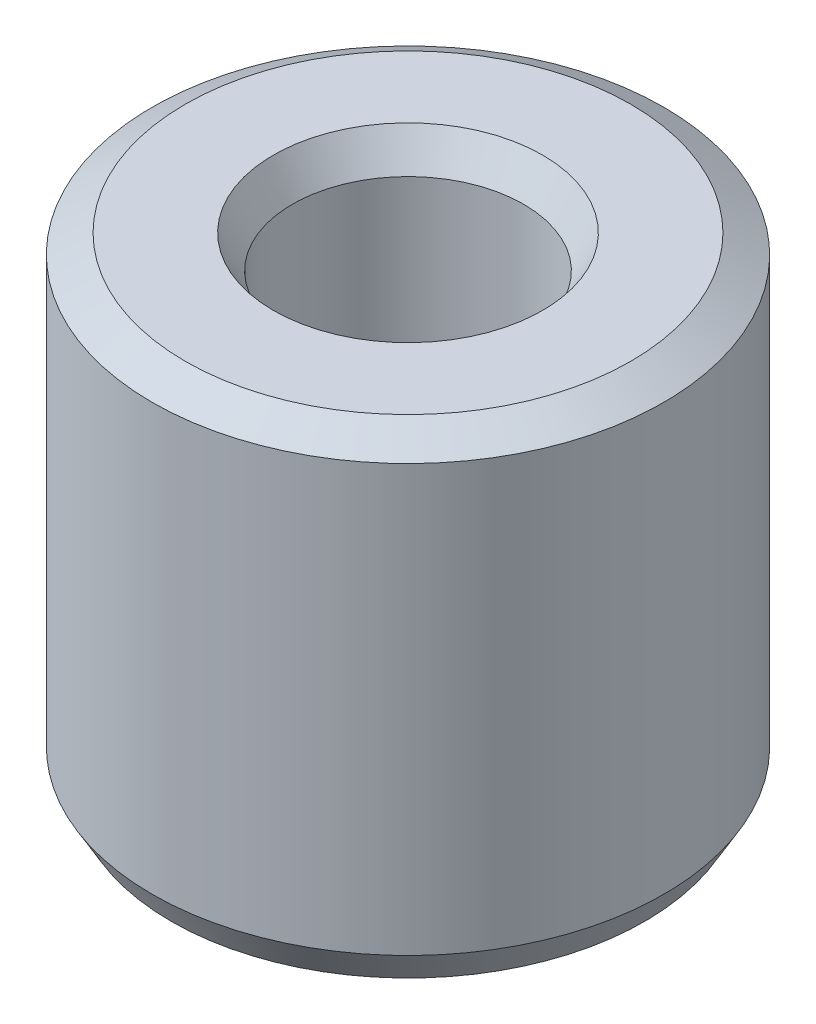
from build123d import *
from OCP.BRepFilletAPI import BRepFilletAPI_MakeChamfer

# Parameters (mm, degrees)
SKETCH1_R           = 5
BOSS_EXTRUDE1_DEPTH = 9.347865609
SKETCH2_R           = 2.259194326
CUT_EXTRUDE1_DEPTH  = 12.721032013
CHAMFER1_SIZE       = 0.372725483
CHAMFER1_SIZE2      = 0.645579473


with BuildPart() as part:
    # Sketch1 → Boss-Extrude1 (new body)
    with BuildSketch(Plane(origin=(0, 0, 0), x_dir=(1, 0, 0), z_dir=(0, 1, 0))):
        Circle(SKETCH1_R)
    extrude(amount=BOSS_EXTRUDE1_DEPTH)

    # Sketch2 → Cut-Extrude1 (cut, through all)
    with BuildSketch(Plane(origin=(0, 0, 0), x_dir=(1, 0, 0), z_dir=(0, 1, 0))):
        Circle(SKETCH2_R)
    extrude(amount=CUT_EXTRUDE1_DEPTH, mode=Mode.SUBTRACT)

    # Chamfer1: one chamfer whose edges measure the first distance from different faces: ONE call of the kernel's chamfer builder (chamfer() names one face for all edges)
    chamfer1_edges_1 = [part.edges().sort_by_distance(p)[0] for p in [
        (-2.259194326, 9.347865609, 0),
    ]]
    chamfer1_side_1 = [part.faces().sort_by_distance(p)[0] for p in [
        (-4.858578644, 9.347865609, 0),
    ]]
    chamfer1_edges_2 = [part.edges().sort_by_distance(p)[0] for p in [
        (-2.259194326, 0, 0),
    ]]
    chamfer1_side_2 = [part.faces().sort_by_distance(p)[0] for p in [
        (-2.259194326, 4.673932805, 0),
    ]]
    chamfer1_edges_3 = [part.edges().sort_by_distance(p)[0] for p in [
        (-5, 0, 0),
    ]]
    chamfer1_side_3 = [part.faces().sort_by_distance(p)[0] for p in [
        (-4.858578644, 0, 0),
    ]]
    chamfer1_edges_4 = [part.edges().sort_by_distance(p)[0] for p in [
        (-5, 9.347865609, 0),
    ]]
    chamfer1_side_4 = [part.faces().sort_by_distance(p)[0] for p in [
        (-5, 4.673932805, 0),
    ]]
    chamfer1 = BRepFilletAPI_MakeChamfer(part.part.solid().wrapped)
    for e in chamfer1_edges_1:
        chamfer1.Add(CHAMFER1_SIZE, CHAMFER1_SIZE2, e.wrapped, chamfer1_side_1[0].wrapped)  # the first distance lies on this face
    for e in chamfer1_edges_2:
        chamfer1.Add(CHAMFER1_SIZE, CHAMFER1_SIZE2, e.wrapped, chamfer1_side_2[0].wrapped)  # the first distance lies on this face
    for e in chamfer1_edges_3:
        chamfer1.Add(CHAMFER1_SIZE, CHAMFER1_SIZE2, e.wrapped, chamfer1_side_3[0].wrapped)  # the first distance lies on this face
    for e in chamfer1_edges_4:
        chamfer1.Add(CHAMFER1_SIZE, CHAMFER1_SIZE2, e.wrapped, chamfer1_side_4[0].wrapped)  # the first distance lies on this face
    add(Compound.cast(chamfer1.Shape()), mode=Mode.REPLACE)


solid = part.part
